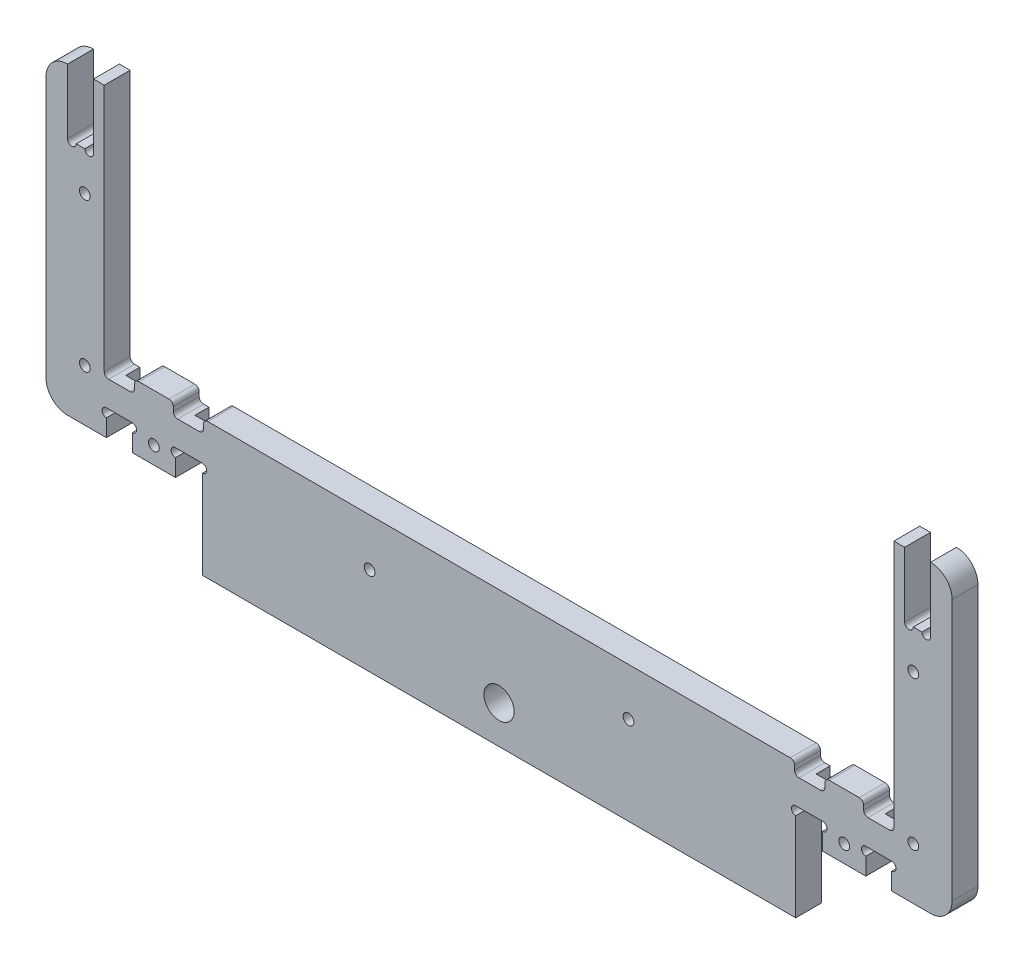
from build123d import *

# Parameters (mm, degrees)
SKETCH1_W                    = 275
SKETCH1_H                    = 33
BOSS_EXTRUDE1_DEPTH          = 12
CUT_EXTRUDE1_REACH           = 141.005
SKETCH2_R                    = 7
BOSS_EXTRUDE2_DEPTH          = 12
CUT_EXTRUDE3_REACH           = 264.774
SKETCH5_W                    = 14
SKETCH5_H                    = 6
FILLET1_R                    = 2
SKETCH17_W                   = 5
SKETCH17_H                   = 24
CUT_EXTRUDE9_DEPTH           = 6.5
CUT_EXTRUDE4_REACH           = 264.774
SKETCH6_W                    = 12
SKETCH6_H                    = 30
F_5_0_5_DIAMETER_HOLE2_D     = 5
F_5_0_5_DIAMETER_HOLE1_D     = 5
F_5_0_5_DIAMETER_HOLE1_DEPTH = 12
F_5_0_5_DIAMETER_HOLE1_TIP   = 1.502151548
FILLET2_R                    = 10
CUT_EXTRUDE5_REACH           = 264.774
CUT_EXTRUDE10_REACH          = 264.774
FILLET1_OF_MIRROR2_R         = 2


with BuildPart() as part:
    # Sketch1 → Boss-Extrude1 (new body)
    with BuildSketch(Plane.XY):
        Rectangle(SKETCH1_W, SKETCH1_H)
    extrude(amount=BOSS_EXTRUDE1_DEPTH)

    # Sketch2 → Cut-Extrude1 (cut, up to next)
    with BuildSketch(Plane.XY.offset(12), mode=Mode.PRIVATE) as cut_extrude1_sk1:
        with Locations((0, 1)):
            Circle(SKETCH2_R)
    cut_extrude1_tool1 = extrude(cut_extrude1_sk1.sketch, amount=-CUT_EXTRUDE1_REACH, mode=Mode.PRIVATE) & part.part
    add(cut_extrude1_tool1.solids().sort_by_distance((0, 1, 12))[0], mode=Mode.SUBTRACT)

    # Sketch3 → Boss-Extrude2 (add)
    with BuildSketch(Plane.XY.offset(12)):
        Polygon((-210, 16.5), (210, 16.5), (210, 157.5), (183, 157.5), (183, 46.5), (-183, 46.5), (-183, 157.5), (-210, 157.5), align=None)
    extrude(amount=-BOSS_EXTRUDE2_DEPTH)

    # Sketch5 → Cut-Extrude3 (cut, up to next)
    with BuildSketch(Plane.XY.offset(12), mode=Mode.PRIVATE) as cut_extrude3_sk1:
        with Locations((-176, 43.5)):
            Rectangle(SKETCH5_W, SKETCH5_H)
    cut_extrude3_tool1 = extrude(cut_extrude3_sk1.sketch, amount=-CUT_EXTRUDE3_REACH, mode=Mode.PRIVATE) & part.part
    # Sketch5 → Cut-Extrude3 (cut, up to next)
    with BuildSketch(Plane.XY.offset(12), mode=Mode.PRIVATE) as cut_extrude3_sk2:
        with Locations((-144, 43.5)):
            Rectangle(SKETCH5_W, SKETCH5_H)
    cut_extrude3_tool2 = extrude(cut_extrude3_sk2.sketch, amount=-CUT_EXTRUDE3_REACH, mode=Mode.PRIVATE) & part.part
    cut_extrude3_1 = cut_extrude3_tool1.solids().sort_by_distance((-176, 43.5, 12))[0]
    add(cut_extrude3_1, mode=Mode.SUBTRACT)
    cut_extrude3_2 = cut_extrude3_tool2.solids().sort_by_distance((-144, 43.5, 12))[0]
    add(cut_extrude3_2, mode=Mode.SUBTRACT)
    cut_extrude3 = cut_extrude3_1 + cut_extrude3_2  # Cut-Extrude3 as one shape, for the pattern or mirror that repeats it

    # Fillet1
    fillet1_edges = [part.edges().sort_by_distance(p)[0] for p in [
        (-169, 46.5, 6),
        (-169, 40.5, 6),
        (-183, 40.5, 6),
        (-151, 46.5, 6),
        (-137, 46.5, 6),
        (-137, 40.5, 6),
        (-151, 40.5, 6),
    ]]
    fillet(fillet1_edges, radius=FILLET1_R)

    # Sketch17 → Cut-Extrude9 (cut)
    with BuildSketch(Plane(origin=(0, 0, 0), x_dir=(-1, 0, 0), z_dir=(0, 0, -1))):
        with Locations((144, 40.5)):
            Rectangle(SKETCH17_W, SKETCH17_H)
        with Locations((176, 40.5)):
            Rectangle(SKETCH17_W, SKETCH17_H)
    cut_extrude9 = extrude(amount=-CUT_EXTRUDE9_DEPTH, mode=Mode.SUBTRACT)

    # Sketch6 → Cut-Extrude4 (cut, up to next)
    with BuildSketch(Plane.XY.offset(12), mode=Mode.PRIVATE) as cut_extrude4_sk1:
        with Locations((-194, 142.5)):
            Rectangle(SKETCH6_W, SKETCH6_H)
    cut_extrude4_tool1 = extrude(cut_extrude4_sk1.sketch, amount=-CUT_EXTRUDE4_REACH, mode=Mode.PRIVATE) & part.part
    cut_extrude4 = cut_extrude4_tool1.solids().sort_by_distance((-194, 142.5, 12))[0]
    add(cut_extrude4, mode=Mode.SUBTRACT)

    # Mirror3: Cut-Extrude4 across plane
    add(cut_extrude4.mirror(Plane(origin=(0, 0, 0), x_dir=(0, 0, 1), z_dir=(1, 0, 0))), mode=Mode.SUBTRACT)

    # Ø5.0 (5) Diameter Hole2 (through all)
    with Locations(Plane.XY.offset(12)):
        with Locations((-192, 40.5), (-192, 109.5)):
            f_5_0_5_diameter_hole2 = Hole(F_5_0_5_DIAMETER_HOLE2_D / 2)

    # Mirror4: Ø5.0 (5) Diameter Hole2 across plane
    add(f_5_0_5_diameter_hole2.mirror(Plane(origin=(0, 0, 0), x_dir=(0, 0, 1), z_dir=(1, 0, 0))), mode=Mode.SUBTRACT)

    # Ø5.0 (5) Diameter Hole1
    with Locations(Plane.XY.offset(12)):
        with Locations((-60, 24.5), (60, 24.5), (-160, 24.5), (160, 24.5)):
            Hole(F_5_0_5_DIAMETER_HOLE1_D / 2, depth=F_5_0_5_DIAMETER_HOLE1_DEPTH)
            with Locations((0, 0, -(F_5_0_5_DIAMETER_HOLE1_DEPTH + F_5_0_5_DIAMETER_HOLE1_TIP / 2))):  # 118° drill point
                Cone(0, F_5_0_5_DIAMETER_HOLE1_D / 2, F_5_0_5_DIAMETER_HOLE1_TIP, mode=Mode.SUBTRACT)

    # Fillet2
    fillet2_edges = [part.edges().sort_by_distance(p)[0] for p in [
        (210, 157.5, 6),
        (210, 16.5, 6),
        (-210, 16.5, 6),
        (-210, 157.5, 6),
    ]]
    fillet(fillet2_edges, radius=FILLET2_R - 0.0001)  # a hair under: the kernel refuses the full size

    # Sketch11 → Cut-Extrude5 (cut, up to next)
    with BuildSketch(Plane(origin=(0, 0, 0), x_dir=(-1, 0, 0), z_dir=(0, 0, -1)), mode=Mode.PRIVATE) as cut_extrude5_sk1:
        with BuildLine():
            Line((-200, 127.5), (-196, 127.5))
            ThreePointArc((-196, 127.5), (-198, 125.5), (-200, 127.5))
        make_face()
    cut_extrude5_tool1 = extrude(cut_extrude5_sk1.sketch, amount=-CUT_EXTRUDE5_REACH, mode=Mode.PRIVATE) & part.part
    # Sketch11 → Cut-Extrude5 (cut, up to next)
    with BuildSketch(Plane(origin=(0, 0, 0), x_dir=(-1, 0, 0), z_dir=(0, 0, -1)), mode=Mode.PRIVATE) as cut_extrude5_sk2:
        with BuildLine():
            Line((-192, 127.5), (-188, 127.5))
            ThreePointArc((-188, 127.5), (-190, 125.5), (-192, 127.5))
        make_face()
    cut_extrude5_tool2 = extrude(cut_extrude5_sk2.sketch, amount=-CUT_EXTRUDE5_REACH, mode=Mode.PRIVATE) & part.part
    # Sketch11 → Cut-Extrude5 (cut, up to next)
    with BuildSketch(Plane(origin=(0, 0, 0), x_dir=(-1, 0, 0), z_dir=(0, 0, -1)), mode=Mode.PRIVATE) as cut_extrude5_sk3:
        with BuildLine():
            Line((188, 127.5), (192, 127.5))
            ThreePointArc((192, 127.5), (190, 125.5), (188, 127.5))
        make_face()
    cut_extrude5_tool3 = extrude(cut_extrude5_sk3.sketch, amount=-CUT_EXTRUDE5_REACH, mode=Mode.PRIVATE) & part.part
    # Sketch11 → Cut-Extrude5 (cut, up to next)
    with BuildSketch(Plane(origin=(0, 0, 0), x_dir=(-1, 0, 0), z_dir=(0, 0, -1)), mode=Mode.PRIVATE) as cut_extrude5_sk4:
        with BuildLine():
            Line((196, 127.5), (200, 127.5))
            ThreePointArc((200, 127.5), (198, 125.5), (196, 127.5))
        make_face()
    cut_extrude5_tool4 = extrude(cut_extrude5_sk4.sketch, amount=-CUT_EXTRUDE5_REACH, mode=Mode.PRIVATE) & part.part
    add(cut_extrude5_tool1.solids().sort_by_distance((198, 126.651174, 0))[0], mode=Mode.SUBTRACT)
    add(cut_extrude5_tool2.solids().sort_by_distance((190, 126.651174, 0))[0], mode=Mode.SUBTRACT)
    add(cut_extrude5_tool3.solids().sort_by_distance((-190, 126.651174, 0))[0], mode=Mode.SUBTRACT)
    add(cut_extrude5_tool4.solids().sort_by_distance((-198, 126.651174, 0))[0], mode=Mode.SUBTRACT)

    # Sketch18 → Cut-Extrude10 (cut, up to next)
    with BuildSketch(Plane(origin=(0, 0, 0), x_dir=(-1, 0, 0), z_dir=(0, 0, -1)), mode=Mode.PRIVATE) as cut_extrude10_sk1:
        with BuildLine():
            Line((150, 16.5), (137.5, 16.5))
            Line((137.5, 16.5), (137.5, 24.5))
            ThreePointArc((137.5, 24.5), (135.5, 26.5), (137.5, 28.5))
            Line((137.5, 28.5), (150, 28.5))
            ThreePointArc((150, 28.5), (152, 26.5), (150, 24.5))
            Line((150, 24.5), (150, 16.5))
        make_face()
    cut_extrude10_tool1 = extrude(cut_extrude10_sk1.sketch, amount=-CUT_EXTRUDE10_REACH, mode=Mode.PRIVATE) & part.part
    # Sketch18 → Cut-Extrude10 (cut, up to next)
    with BuildSketch(Plane(origin=(0, 0, 0), x_dir=(-1, 0, 0), z_dir=(0, 0, -1)), mode=Mode.PRIVATE) as cut_extrude10_sk2:
        with BuildLine():
            Line((170, 16.5), (182, 16.5))
            Line((182, 16.5), (182, 24.5))
            ThreePointArc((182, 24.5), (184, 26.5), (182, 28.5))
            Line((182, 28.5), (170, 28.5))
            ThreePointArc((170, 28.5), (168, 26.5), (170, 24.5))
            Line((170, 24.5), (170, 16.5))
        make_face()
    cut_extrude10_tool2 = extrude(cut_extrude10_sk2.sketch, amount=-CUT_EXTRUDE10_REACH, mode=Mode.PRIVATE) & part.part
    cut_extrude10_1 = cut_extrude10_tool1.solids().sort_by_distance((-143.75, 22.8092, 0))[0]
    add(cut_extrude10_1, mode=Mode.SUBTRACT)
    cut_extrude10_2 = cut_extrude10_tool2.solids().sort_by_distance((-176, 22.821049, 0))[0]
    add(cut_extrude10_2, mode=Mode.SUBTRACT)
    cut_extrude10 = cut_extrude10_1 + cut_extrude10_2  # Cut-Extrude10 as one shape, for the pattern or mirror that repeats it

    # Mirror2: Cut-Extrude3, Cut-Extrude9, Cut-Extrude10 across plane
    add(cut_extrude3.mirror(Plane(origin=(0, 0, 0), x_dir=(0, 0, 1), z_dir=(1, 0, 0))), mode=Mode.SUBTRACT)
    add(cut_extrude9.mirror(Plane(origin=(0, 0, 0), x_dir=(0, 0, 1), z_dir=(1, 0, 0))), mode=Mode.SUBTRACT)
    add(cut_extrude10.mirror(Plane(origin=(0, 0, 0), x_dir=(0, 0, 1), z_dir=(1, 0, 0))), mode=Mode.SUBTRACT)

    # Fillet1 of Mirror2
    fillet1_of_mirror2_edges = [part.edges().sort_by_distance(p)[0] for p in [
        (169, 46.5, 6),
        (169, 40.5, 6),
        (183, 40.5, 6),
        (151, 46.5, 6),
        (137, 46.5, 6),
        (137, 40.5, 6),
        (151, 40.5, 6),
    ]]
    fillet(fillet1_of_mirror2_edges, radius=FILLET1_OF_MIRROR2_R)


solid = part.part
